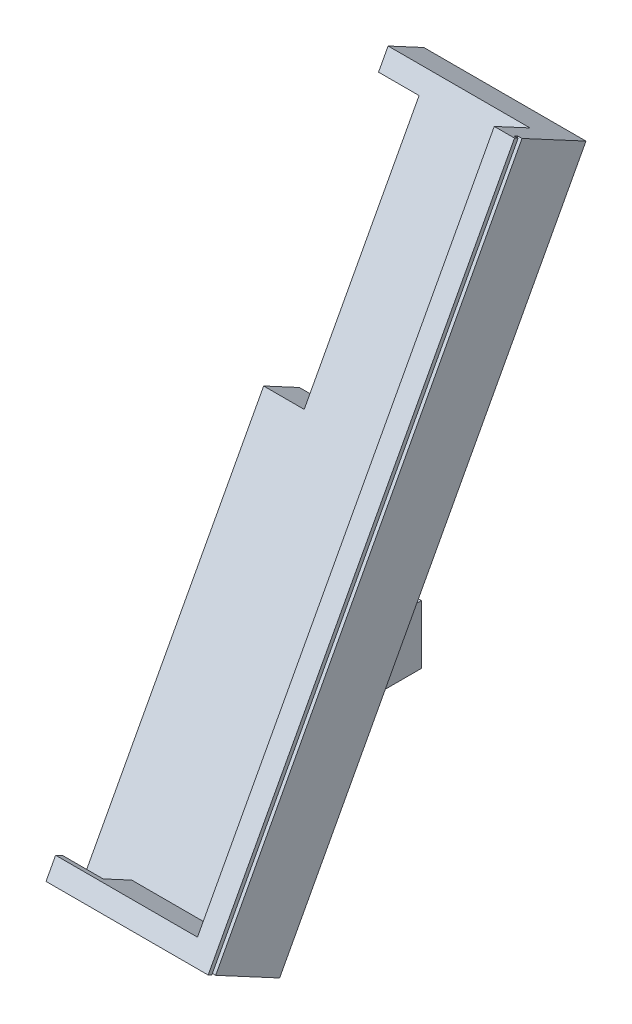
from build123d import *

# Parameters (mm, degrees)
SKETCH_1_W               = 39.5
SKETCH_1_H               = 14.5
EXTRUDE_1_DEPTH          = 40
SKETCH_6_W               = 80
SKETCH_6_H               = 160
EXTRUDE_2_DEPTH          = 10
EXTRUDE_3_DEPTH          = 10
SKETCH_8_W               = 40
SKETCH_8_H               = 60
CUT_EXTRUDE_1_DEPTH      = 10
SKETCH_9_W               = 20
SKETCH_9_H               = 8
CUT_EXTRUDE_3_DEPTH      = 10
CUT_EXTRUDE_4_DEPTH      = 158.764612799
CUT_EXTRUDE_4_DEPTH_BACK = 1
CUT_EXTRUDE_5_DEPTH      = 1
SKETCH_13_W              = 120.718307012
SKETCH_13_H              = 167.595175371
CUT_EXTRUDE_7_DEPTH      = 40


with BuildPart() as part:
    # 草图1 → 凸台-拉伸1 (new body)
    with BuildSketch(Plane.XY):
        Rectangle(SKETCH_1_W, SKETCH_1_H)
    extrude(amount=EXTRUDE_1_DEPTH)

    # 草图6 → 凸台-拉伸2 (add)
    with BuildSketch(Plane(origin=(0, 15.03668382, 28.054947672), x_dir=(1, 0, 0), z_dir=(0, 0.4723983215829414, 0.8813851744643881))):
        with Locations((0, 22.485349826)):
            Rectangle(SKETCH_6_W, SKETCH_6_H)
    extrude(amount=EXTRUDE_2_DEPTH)

    # 草图7 → 凸台-拉伸3 (add)
    with BuildSketch(Plane(origin=(0, 19.760667036, 36.868799416), x_dir=(1, 0, 0), z_dir=(0, 0.4723983215829416, 0.881385174464388))):
        Polygon((-35, -52.514650174), (35, -52.514650174), (35, 102.485349826), (40, 102.485349826), (40, -57.514650174), (-40, -57.514650174), (-40, 102.485349826), (-35, 102.485349826), align=None)
    extrude(amount=EXTRUDE_3_DEPTH)

    # 草图8 → 切除-拉伸1 (cut)
    with BuildSketch(Plane(origin=(0, 19.760667036, 36.868799416), x_dir=(1, 0, 0), z_dir=(0, 0.47239832158294137, 0.8813851744643881))):
        with Locations((-10, 67.485349826)):
            Rectangle(SKETCH_8_W, SKETCH_8_H)
    extrude(amount=-CUT_EXTRUDE_1_DEPTH, mode=Mode.SUBTRACT)

    # 草图9 → 切除-拉伸3 (cut)
    with BuildSketch(Plane(origin=(0, -50.692559978, 27.169824208), x_dir=(1, 0, 0), z_dir=(0, -0.881385174464388, 0.47239832158294154))):
        with Locations((-0.027304515, 45.830519147)):
            Rectangle(SKETCH_9_W, SKETCH_9_H)
    extrude(amount=-CUT_EXTRUDE_3_DEPTH, mode=Mode.SUBTRACT)

    # 草图10 → 切除-拉伸4 (cut, two sides: drawn at the far end of the back side and taken through both)
    with BuildSketch(Plane.ZY.offset(40).offset(-CUT_EXTRUDE_4_DEPTH_BACK)):
        Polygon((235.352563611, -333.840604393), (71.001566503, -27.199946201), (-4.58216495, 113.821681713), (-3.612641258, 114.341319867), (71.971090195, -26.680308047), (236.322087302, -333.320966239), (565.024081517, -946.602282623), (564.054557825, -947.121920777), align=None)
    extrude(amount=CUT_EXTRUDE_4_DEPTH + CUT_EXTRUDE_4_DEPTH_BACK, mode=Mode.SUBTRACT)

    # 草图11 → 切除-拉伸5 (cut)
    with BuildSketch(Plane(origin=(40, 0, 0), x_dir=(0, 0, -1), z_dir=(1, 0, 0))):
        Polygon((3.612641258, 114.341319867), (-71.971090195, -26.680308047), (-71.001566503, -27.199946201), (4.58216495, 113.821681713), align=None)
    extrude(amount=-CUT_EXTRUDE_5_DEPTH, mode=Mode.SUBTRACT)

    # 草图13 → 切除-拉伸7 (cut)
    with BuildSketch(Plane.ZY.offset(40)):
        with Locations((25.209659041, 38.852951816)):
            Rectangle(SKETCH_13_W, SKETCH_13_H)
    extrude(amount=-CUT_EXTRUDE_7_DEPTH, mode=Mode.SUBTRACT)


solid = part.part
